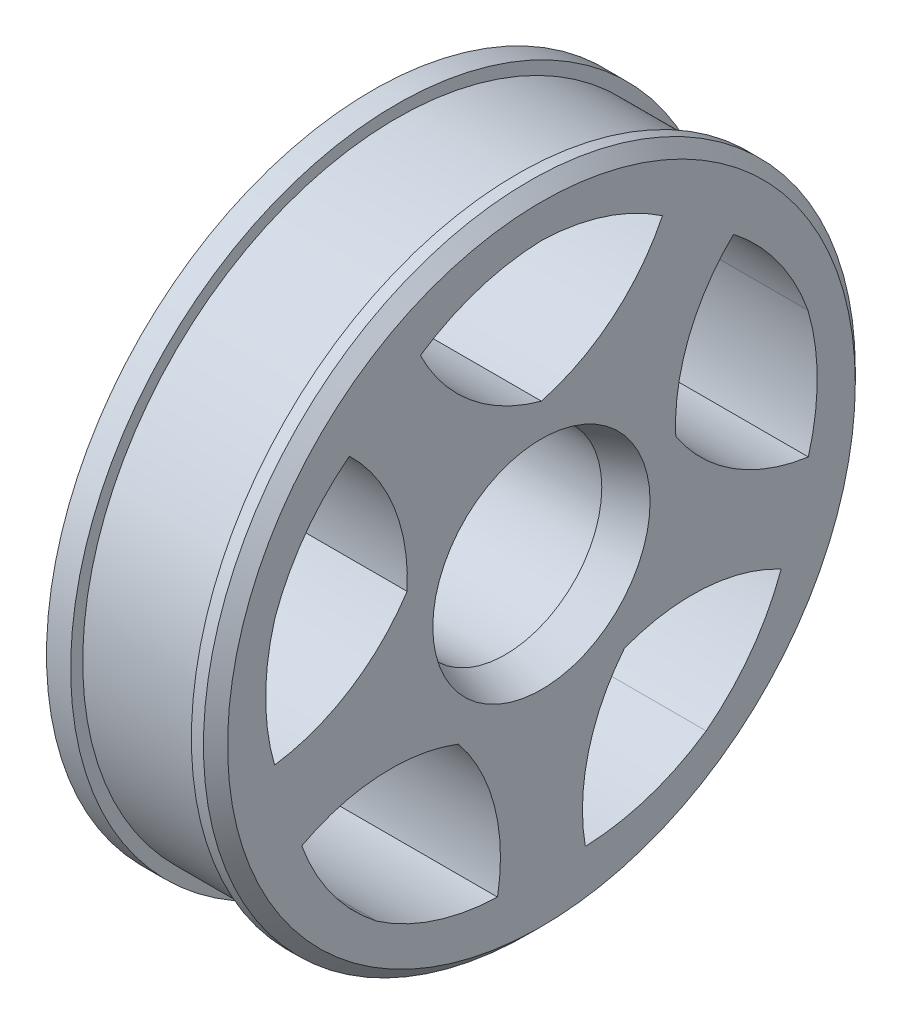
from build123d import *

# Parameters (mm, degrees)
SKETCH1_R           = 13.5
SKETCH1_R_2         = 4
BOSS_EXTRUDE1_DEPTH = 3.5
CUT_EXTRUDE1_DEPTH  = 20.410048944
CIRPATTERN1_COUNT   = 5
CHAMFER1_SIZE       = 0.5
SKETCH4_R           = 13.5
SKETCH4_R_2         = 13
CUT_EXTRUDE3_DEPTH  = 2.5
CHAMFER2_SIZE       = 0.5
CHAMFER2_SIZE2      = 1.5


with BuildPart() as part:
    # Sketch1 → Boss-Extrude1 (new, symmetric)
    with BuildSketch(Plane(origin=(0, 0, 0), x_dir=(0, 0, -1), z_dir=(1, 0, 0))):
        Circle(SKETCH1_R)
        Circle(SKETCH1_R_2, mode=Mode.SUBTRACT)
    extrude(amount=BOSS_EXTRUDE1_DEPTH, both=True)

    # Sketch2 → Cut-Extrude1 (cut, symmetric)
    with BuildSketch(Plane(origin=(0, 0, 0), x_dir=(0, 0, -1), z_dir=(1, 0, 0))):
        with BuildLine():
            ThreePointArc((0, 5.849695328), (-2.956289657, 7.377375059), (-5.012219469, 9.99397715))
            ThreePointArc((-5.012219469, 9.99397715), (-2.621563936, 11.159720287), (0, 11.6087119))
            ThreePointArc((0, 11.6087119), (2.621563936, 11.159720287), (5.012219469, 9.99397715))
            ThreePointArc((5.012219469, 9.99397715), (2.956289657, 7.377375059), (0, 5.849695328))
        make_face()
    cut_extrude1 = extrude(amount=CUT_EXTRUDE1_DEPTH, both=True, mode=Mode.SUBTRACT)

    # CirPattern1: Cut-Extrude1 ×5 about axis
    cirpattern1_axis = Axis((3.5, 0, 0), (-1, 0, 0))
    for i in range(1, CIRPATTERN1_COUNT):
        add(cut_extrude1.rotate(cirpattern1_axis, i * 360 / CIRPATTERN1_COUNT), mode=Mode.SUBTRACT)

    # Chamfer1
    chamfer1_edges = [part.edges().sort_by_distance(p)[0] for p in [
        (3.5, 0, 13.5),
    ]]
    chamfer(chamfer1_edges, length=CHAMFER1_SIZE)

    # Sketch4 → Cut-Extrude3 (cut, symmetric)
    with BuildSketch(Plane(origin=(0, 0, 0), x_dir=(0, 0, -1), z_dir=(1, 0, 0))):
        Circle(SKETCH4_R)
        Circle(SKETCH4_R_2, mode=Mode.SUBTRACT)
    extrude(amount=CUT_EXTRUDE3_DEPTH, both=True, mode=Mode.SUBTRACT)

    # Chamfer2
    chamfer2_edges = [part.edges().sort_by_distance(p)[0] for p in [
        (3.5, 0, 4),
    ]]
    chamfer2_side = [part.faces().sort_by_distance(p)[0] for p in [
        (3.5, 0, 12.632304474),
    ]]
    chamfer(chamfer2_edges, length=CHAMFER2_SIZE, length2=CHAMFER2_SIZE2, reference=chamfer2_side[0])


solid = part.part
